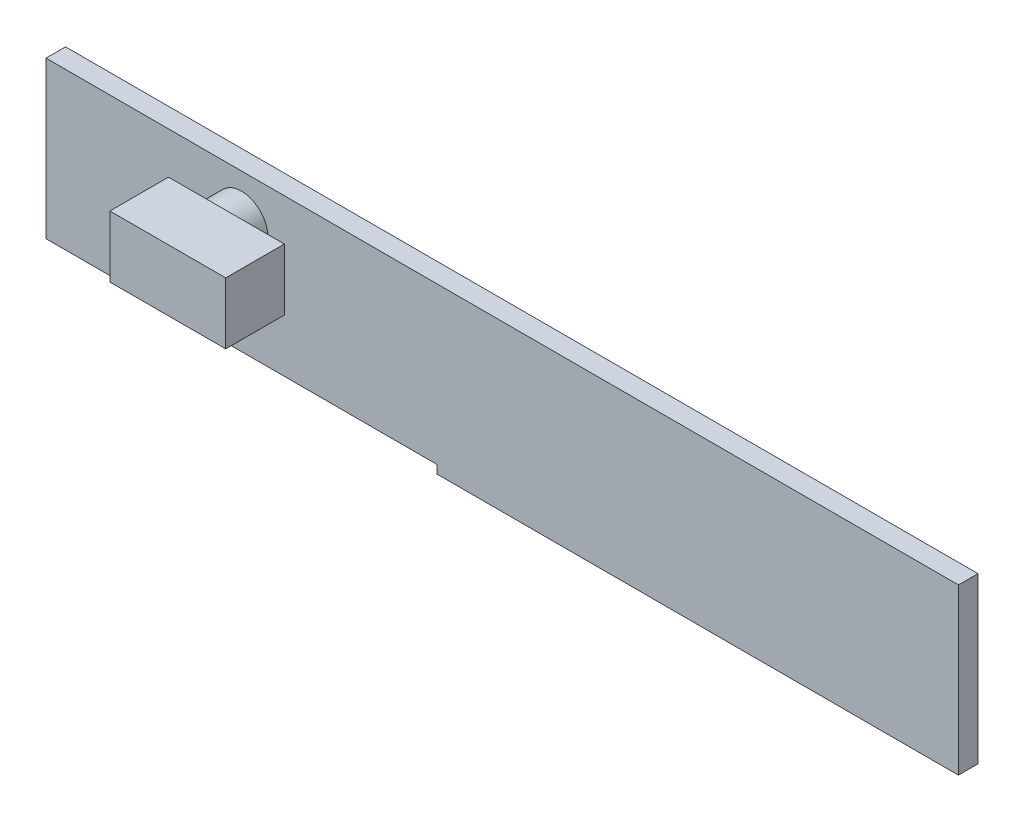
from build123d import *

# Parameters (mm, degrees)
SKETCH2_W           = 254
SKETCH2_H           = 12.7
BOSS_EXTRUDE1_DEPTH = 101.6
SKETCH3_R           = 17.140791438
BOSS_EXTRUDE2_DEPTH = 19.05
SKETCH4_W           = 75.235944222
SKETCH4_H           = 39.955088207
BOSS_EXTRUDE3_DEPTH = 38.1
SCALE2_SCALE        = 0.00375
ROTATE_ANGLE        = 90
SKETCH6_W           = 1.27
SKETCH6_H           = 0.047625
BOSS_EXTRUDE6_DEPTH = 0.40132


with BuildPart() as part:
    # Sketch2 → Boss-Extrude1 (new body)
    with BuildSketch(Plane.XY):
        with Locations((79.130769231, 14.898076923)):
            Rectangle(SKETCH2_W, SKETCH2_H)
    extrude(amount=BOSS_EXTRUDE1_DEPTH)

    # Sketch3 → Boss-Extrude2 (add)
    with BuildSketch(Plane(origin=(0, 21.248076923, 0), x_dir=(1, 0, 0), z_dir=(0, 1, 0))):
        with Locations((79.130769231, -28.483063876)):
            Circle(SKETCH3_R)
    extrude(amount=BOSS_EXTRUDE2_DEPTH)

    # Sketch4 → Boss-Extrude3 (add)
    with BuildSketch(Plane(origin=(0, 40.298076923, 0), x_dir=(1, 0, 0), z_dir=(0, 1, 0))):
        with Locations((88.38546847, -28.088530296)):
            Rectangle(SKETCH4_W, SKETCH4_H)
    extrude(amount=BOSS_EXTRUDE3_DEPTH)


with BuildPart() as part_1:
    # Scale2: scaled about (81.435728249, 26.575729378, 44.290186425)
    add(part.part.scale(SCALE2_SCALE).moved(Location((81.130344268, 26.476070393, 44.124098226))))


with BuildPart() as part_2:
    # rotate: moved
    add(part_1.part.rotate(Axis((0, 33.666927966, 26.550068274), (1, 0, 0)), ROTATE_ANGLE))


with BuildPart() as part_3:
    # Move Body 4 x: moved
    add(part_2.part.moved(Location((-101.6, 0, 0))))


with BuildPart() as part_4:
    # Move Body 2 y: moved
    add(part_3.part.moved(Location((0, -55.88, 0))))


with BuildPart() as part_5:
    # Move Body 2.1z: moved
    add(part_4.part.moved(Location((0, 0, -30.48))))

    # Sketch6 → Boss-Extrude6 (add)
    with BuildSketch(Plane(origin=(0, -39.787101985, 0), x_dir=(1, 0, 0), z_dir=(0, 1, 0))):
        with Locations((-19.061665348, 11.064921511)):
            Rectangle(SKETCH6_W, SKETCH6_H)
    extrude(amount=-BOSS_EXTRUDE6_DEPTH)


solid = part_5.part
